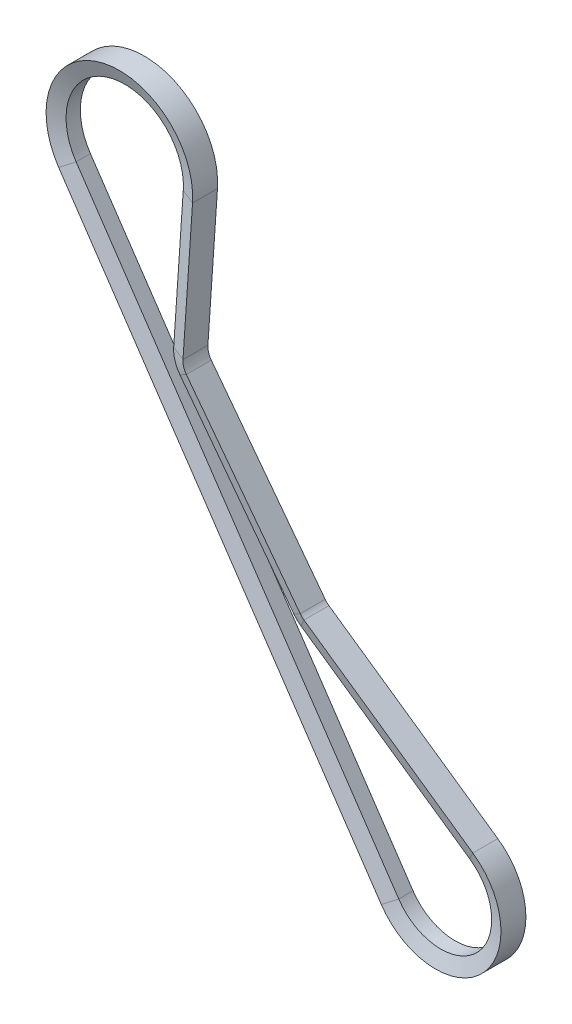
from build123d import *


with BuildPart() as part:
    # Sweep1: sweep along a path in Sketch2
    with BuildLine(Plane.XY) as sweep1_path:
        Line((-92.808358502, 182.002000004), (-96.462141002, 128.360354943))
        ThreePointArc((-96.462141002, 128.360354943), (-96.210861815, 126.110326366), (-95.186183301, 124.091464368))
        Line((-95.186183301, 124.091464368), (-51.675932738, 66.725463148))
        ThreePointArc((-51.675932738, 66.725463148), (-51.012160663, 65.98010975), (-50.239797955, 65.347969809))
        Line((-50.239797955, 65.347969809), (14.264676474, 20.530928013))
        ThreePointArc((14.264676474, 20.530928013), (17.565824006, -17.788811848), (-20.709227056, -14.004567638))
        Line((-20.709227056, -14.004567638), (-143.937963458, 168.219685755))
        ThreePointArc((-143.937963458, 168.219685755), (-128.03109551, 210.93983127), (-92.808358502, 182.002000004))
    # Sketch3 → Sweep1 (sweep)
    with BuildSketch(Plane(origin=(14.264676474, 20.530928013, 0), x_dir=(0, 0, -1), z_dir=(0.8212371205290357, -0.5705870589710023, 0))):
        Polygon((-4.7625, 0), (4.7625, 0), (2.728634331, -5.588), (-2.728634331, -5.588), align=None)
    sweep(path=sweep1_path.line)


solid = part.part
